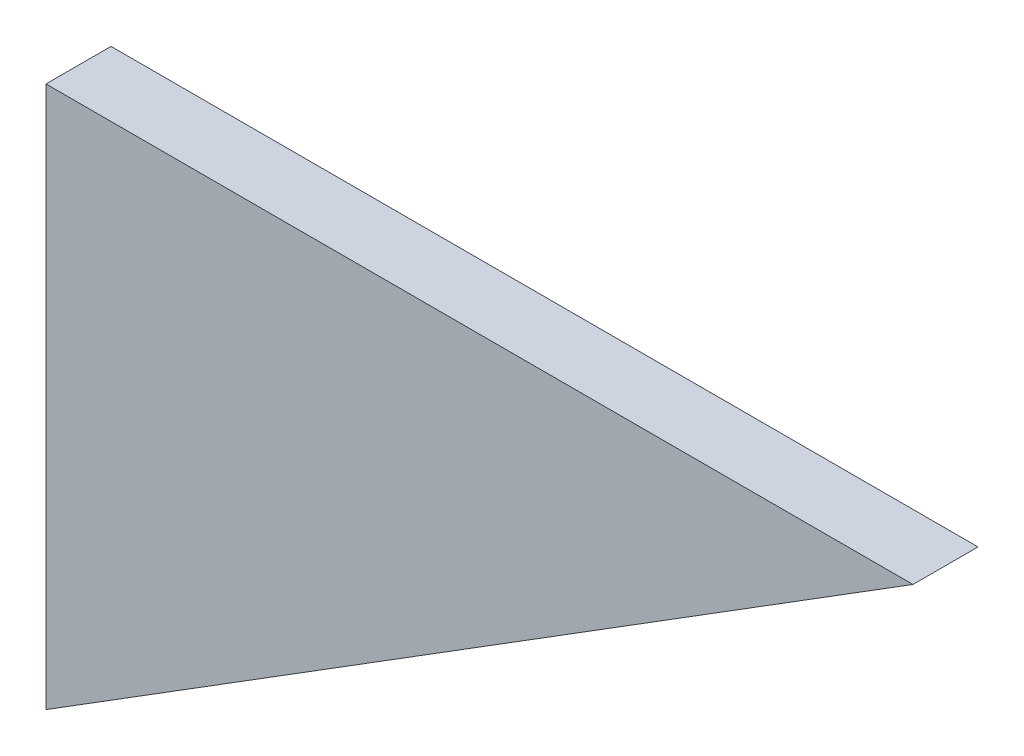
from build123d import *

# Parameters (mm, degrees)
EXTRUDE_1_DEPTH = 6


with BuildPart() as part:
    # Эскиз1 → Бобышка-Вытянуть1 (new body)
    with BuildSketch(Plane.XY):
        Polygon((6, -293.846153846), (6, -343.846153846), (86, -293.846153846), align=None)
    extrude(amount=-EXTRUDE_1_DEPTH)


solid = part.part
